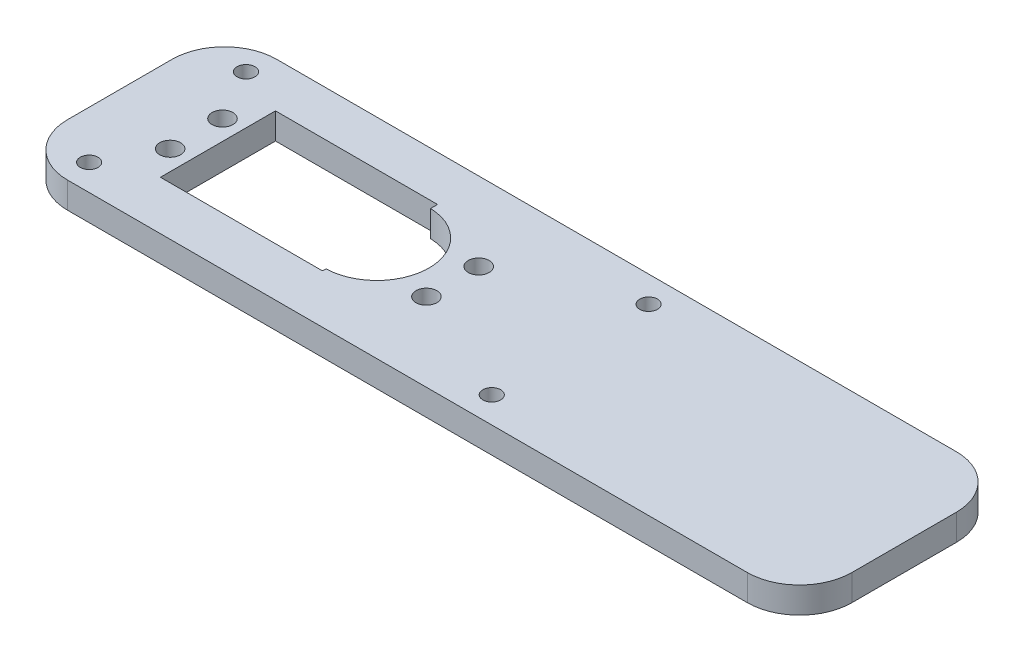
from build123d import *

# Parameters (mm, degrees)
SKETCH9_W           = 150
SKETCH9_H           = 40
BOSS_EXTRUDE5_DEPTH = 5
SKETCH10_R          = 2
CUT_EXTRUDE5_DEPTH  = 103.952823134
SKETCH11_R          = 1.7
CUT_EXTRUDE6_DEPTH  = 103.952823134
FILLET1_R           = 10


with BuildPart() as part:
    # Sketch9 → Boss-Extrude5 (new body)
    with BuildSketch(Plane(origin=(0, 0, 0), x_dir=(1, 0, 0), z_dir=(0, 1, 0))):
        with Locations((25.867654831, 0)):
            Rectangle(SKETCH9_W, SKETCH9_H)
    extrude(amount=BOSS_EXTRUDE5_DEPTH)

    # Sketch10 → Cut-Extrude5 (cut, through all)
    with BuildSketch(Plane(origin=(0, 5, 0), x_dir=(1, 0, 0), z_dir=(0, 1, 0))):
        with BuildLine():
            Line((0.292318991, 11.338961004), (-30.707681009, 11.345685511))
            Line((-30.707681009, 11.345685511), (-30.711010445, -10.656347446))
            Line((-30.711010445, -10.656347446), (0.292318991, -10.661038996))
            Line((0.292318991, -10.661038996), (0.292318991, -9.995726567))
            ThreePointArc((0.292318991, -9.995726567), (10, 0), (0.292318991, 9.995726567))
            Line((0.292318991, 9.995726567), (0.292318991, 11.338961004))
        make_face()
        with Locations((14.5, 5)):
            Circle(SKETCH10_R)
        with Locations((14.5, -5)):
            Circle(SKETCH10_R)
        with Locations((-34.5, 5)):
            Circle(SKETCH10_R)
        with Locations((-34.5, -5)):
            Circle(SKETCH10_R)
    extrude(amount=-CUT_EXTRUDE5_DEPTH, mode=Mode.SUBTRACT)

    # Sketch11 → Cut-Extrude6 (cut, through all)
    with BuildSketch(Plane(origin=(0, 5, 0), x_dir=(1, 0, 0), z_dir=(0, 1, 0))):
        with Locations((-40, 15)):
            Circle(SKETCH11_R)
        with Locations((37, 15)):
            Circle(SKETCH11_R)
        with Locations((37, -15)):
            Circle(SKETCH11_R)
        with Locations((-40, -15)):
            Circle(SKETCH11_R)
    extrude(amount=-CUT_EXTRUDE6_DEPTH, mode=Mode.SUBTRACT)

    # Fillet1
    fillet1_edges = [part.edges().sort_by_distance(p)[0] for p in [
        (100.867654831, 2.5, 20),
        (-49.132345169, 2.5, 20),
        (-49.132345169, 2.5, -20),
        (100.867654831, 2.5, -20),
    ]]
    fillet(fillet1_edges, radius=FILLET1_R)


solid = part.part
